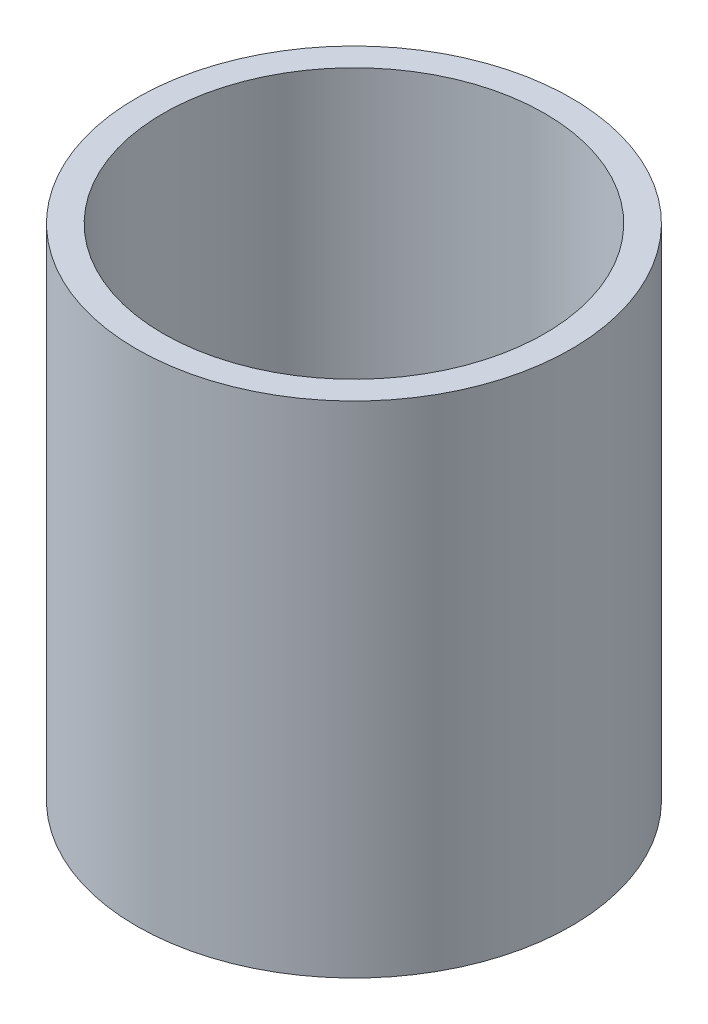
from build123d import *

# Parameters (mm, degrees)
SKETCH1_R           = 27.5
BOSS_EXTRUDE1_DEPTH = 63.203558717
SKETCH2_R           = 24.129737581
CUT_EXTRUDE1_DEPTH  = 75.210442894


with BuildPart() as part:
    # Sketch1 → Boss-Extrude1 (new body)
    with BuildSketch(Plane(origin=(0, 0, 0), x_dir=(1, 0, 0), z_dir=(0, 1, 0))):
        Circle(SKETCH1_R)
    extrude(amount=BOSS_EXTRUDE1_DEPTH)

    # Sketch2 → Cut-Extrude1 (cut, through all)
    with BuildSketch(Plane(origin=(0, 0, 0), x_dir=(1, 0, 0), z_dir=(0, 1, 0))):
        Circle(SKETCH2_R)
    extrude(amount=CUT_EXTRUDE1_DEPTH, mode=Mode.SUBTRACT)


solid = part.part
